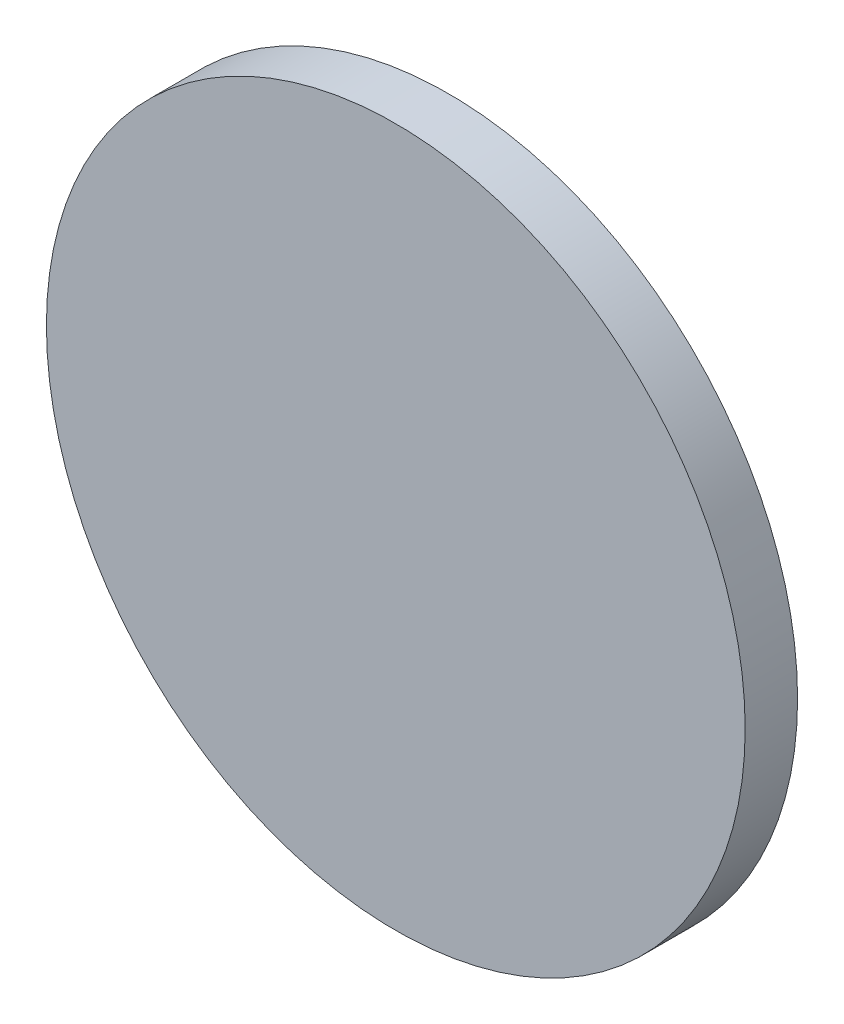
from build123d import *

# Parameters (mm, degrees)
ESQUISSE1_R        = 10
BOSS_EXTRU_1_DEPTH = 1.5


with BuildPart() as part:
    # Esquisse1 → Boss.-Extru.1 (new body)
    with BuildSketch(Plane.XY):
        Circle(ESQUISSE1_R)
    extrude(amount=BOSS_EXTRU_1_DEPTH)


solid = part.part
